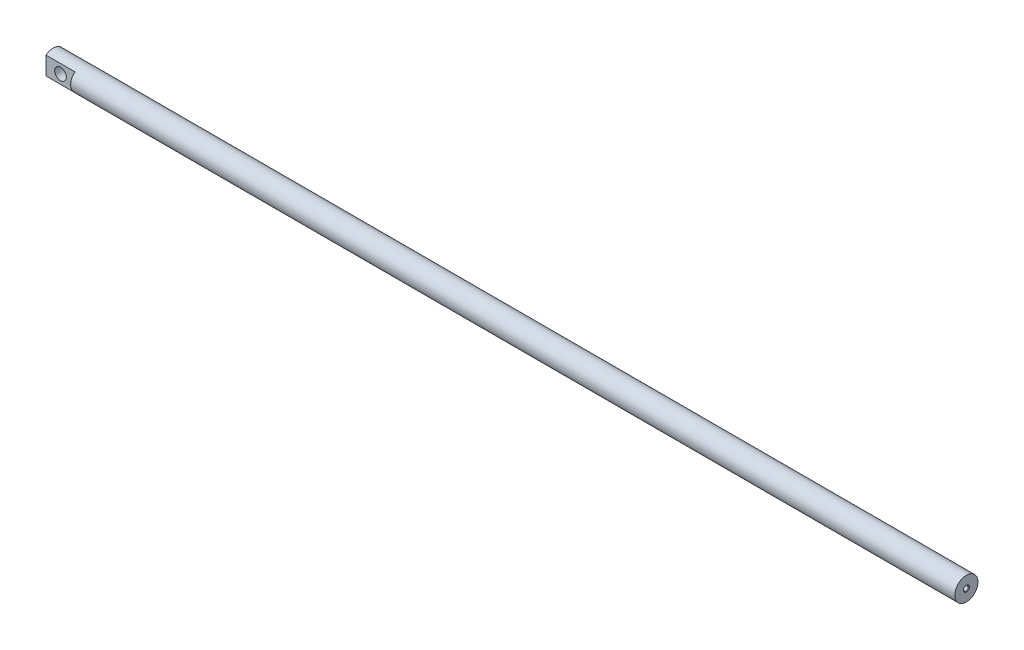
from build123d import *

# Parameters (mm, degrees)
SKETCH_1_R                   = 8
EXTRUDE_1_DEPTH              = 630
SKETCH_3_OUTSIDE_W           = 144.082
SKETCH_3_OUTSIDE_H           = 144.082
SKETCH_3_OUTSIDE_W_2         = 10
SKETCH_3_OUTSIDE_H_2         = 20
CUT_EXTRUDE_1_DEPTH          = 20
SKETCH_4_R                   = 4
CUT_EXTRUDE_3_DEPTH          = 20
HOLE_WIZARD_M4_1_D           = 3.3
HOLE_WIZARD_M4_1_DEPTH       = 10
HOLE_WIZARD_M4_1_CSINK_D     = 4.05
HOLE_WIZARD_M4_1_CSINK_ANGLE = 90
HOLE_WIZARD_M4_1_TIP         = 0.991420021


with BuildPart() as part:
    # 草图1 → 凸台-拉伸1 (new body)
    with BuildSketch(Plane(origin=(0, 0, 0), x_dir=(0, 0, -1), z_dir=(1, 0, 0))):
        Circle(SKETCH_1_R)
    extrude(amount=EXTRUDE_1_DEPTH)

    # 草图3 outside → 切除-拉伸1 (cut)
    with BuildSketch(Plane.ZY):
        Rectangle(SKETCH_3_OUTSIDE_W, SKETCH_3_OUTSIDE_H)
        Rectangle(SKETCH_3_OUTSIDE_W_2, SKETCH_3_OUTSIDE_H_2, mode=Mode.SUBTRACT)
    extrude(amount=-CUT_EXTRUDE_1_DEPTH, mode=Mode.SUBTRACT)

    # 草图4 → 切除-拉伸3 (cut)
    with BuildSketch(Plane(origin=(0, 0, -5), x_dir=(-1, 0, 0), z_dir=(0, 0, -1))):
        with Locations((-10, 0)):
            Circle(SKETCH_4_R)
    extrude(amount=-CUT_EXTRUDE_3_DEPTH, mode=Mode.SUBTRACT)

    # M4 螺纹孔1
    with Locations(Plane(origin=(630, 0, 0), x_dir=(0, 0, 1), z_dir=(1, 0, 0))):
        with Locations((0, 0)):
            CounterSinkHole(HOLE_WIZARD_M4_1_D / 2, HOLE_WIZARD_M4_1_CSINK_D / 2, depth=HOLE_WIZARD_M4_1_DEPTH, counter_sink_angle=HOLE_WIZARD_M4_1_CSINK_ANGLE)
            with Locations((0, 0, -(HOLE_WIZARD_M4_1_DEPTH + HOLE_WIZARD_M4_1_TIP / 2))):  # 118° drill point
                Cone(0, HOLE_WIZARD_M4_1_D / 2, HOLE_WIZARD_M4_1_TIP, mode=Mode.SUBTRACT)


solid = part.part
